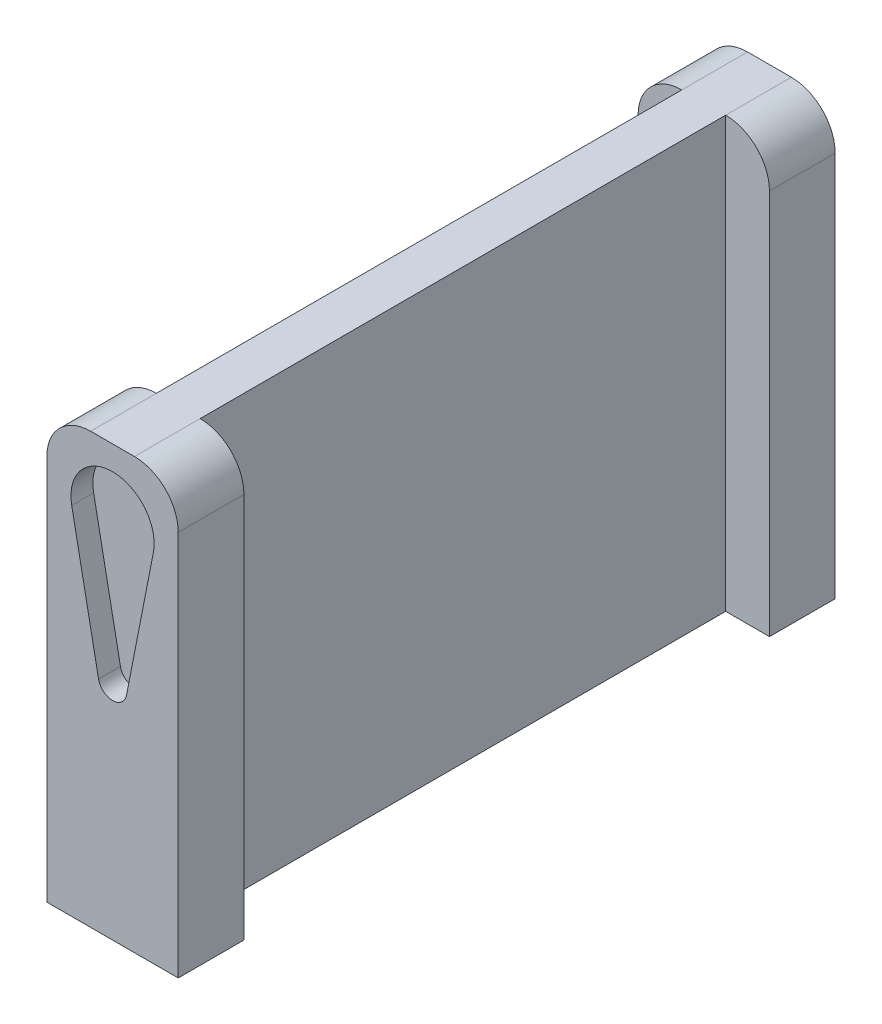
from build123d import *

# Parameters (mm, degrees)
BOSS_EXTRUDE2_DEPTH = 39.25
CUT_EXTRUDE1_DEPTH  = 2
FILLET1_R           = 4


with BuildPart() as part:
    # Sketch4 → Boss-Extrude2 (new body)
    with BuildSketch(Plane(origin=(0, 6, 0), x_dir=(1, 0, 0), z_dir=(0, 1, 0))):
        Polygon((-6, 30), (6, 30), (6, 24), (2, 24), (2, -24), (6, -24), (6, -30), (-6, -30), (-6, -24), (-2, -24), (-2, 24), (-6, 24), align=None)
    extrude(amount=-BOSS_EXTRUDE2_DEPTH)

    # Sketch5 → Cut-Extrude1 (cut)
    with BuildSketch(Plane.XY.offset(30)):
        with BuildLine():
            Line((3.729071779, -0.730769231), (1.275735082, -13.25))
            ThreePointArc((1.275735082, -13.25), (0, -14.3), (-1.275735082, -13.25))
            Line((-1.275735082, -13.25), (-3.729071779, -0.730769231))
            ThreePointArc((-3.729071779, -0.730769231), (0, 3.8), (3.729071779, -0.730769231))
        make_face()
    cut_extrude1 = extrude(amount=-CUT_EXTRUDE1_DEPTH, mode=Mode.SUBTRACT)

    # Mirror1: Cut-Extrude1 across plane
    add(cut_extrude1.mirror(Plane.XY), mode=Mode.SUBTRACT)

    # Fillet1
    fillet1_edges = [part.edges().sort_by_distance(p)[0] for p in [
        (-6, 6, -27),
        (6, 6, -27),
        (6, 6, 27),
        (-6, 6, 27),
    ]]
    fillet(fillet1_edges, radius=FILLET1_R)


solid = part.part
